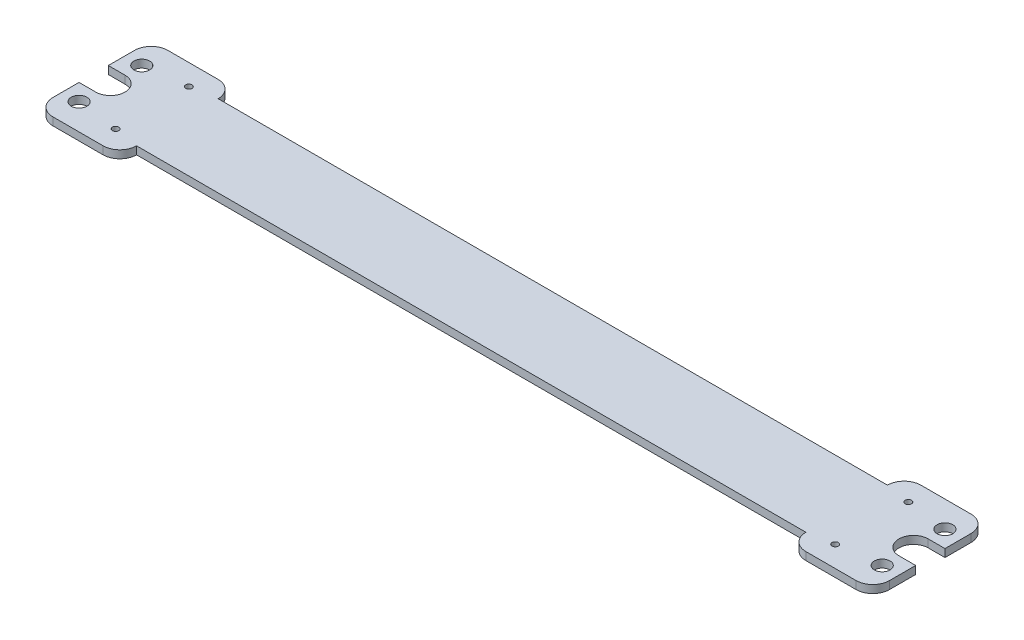
from build123d import *

# Parameters (mm, degrees)
SKETCH1_R           = 4.7625
SKETCH1_R_2         = 1.905
BOSS_EXTRUDE1_DEPTH = 4.7625


with BuildPart() as part:
    # Sketch1 → Boss-Extrude1 (new body)
    with BuildSketch(Plane(origin=(0, 0, 0), x_dir=(1, 0, 0), z_dir=(0, 1, 0))):
        with BuildLine():
            Line((10.16, 0), (40.64, 0))
            ThreePointArc((40.64, 0), (47.824204897, -2.975795103), (50.8, -10.16))
            Line((50.8, -10.16), (254, -10.16))
            Line((254, -10.16), (254, -59.69))
            Line((254, -59.69), (50.8, -59.69))
            ThreePointArc((50.8, -59.69), (47.824204897, -66.874204897), (40.64, -69.85))
            Line((40.64, -69.85), (10.16, -69.85))
            ThreePointArc((10.16, -69.85), (2.975795103, -66.874204897), (0, -59.69))
            Line((0, -59.69), (0, -43.815))
            Line((0, -43.815), (10.16, -43.815))
            ThreePointArc((10.16, -43.815), (19.05, -34.925), (10.16, -26.035))
            Line((10.16, -26.035), (0, -26.035))
            Line((0, -26.035), (0, -10.16))
            ThreePointArc((0, -10.16), (2.975795103, -2.975795103), (10.16, 0))
        make_face()
        with Locations((10.16, -53.975)):
            Circle(SKETCH1_R, mode=Mode.SUBTRACT)
        with Locations((10.16, -15.875)):
            Circle(SKETCH1_R, mode=Mode.SUBTRACT)
        with Locations((35.56, -57.15)):
            Circle(SKETCH1_R_2, mode=Mode.SUBTRACT)
        with Locations((35.56, -12.7)):
            Circle(SKETCH1_R_2, mode=Mode.SUBTRACT)
    boss_extrude1 = extrude(amount=BOSS_EXTRUDE1_DEPTH)

    # Mirror1: Boss-Extrude1 across plane
    add(boss_extrude1.mirror(Plane(origin=(254, 4.7625, 10.16), x_dir=(0, 0, 1), z_dir=(-1, 0, 0))))


solid = part.part
